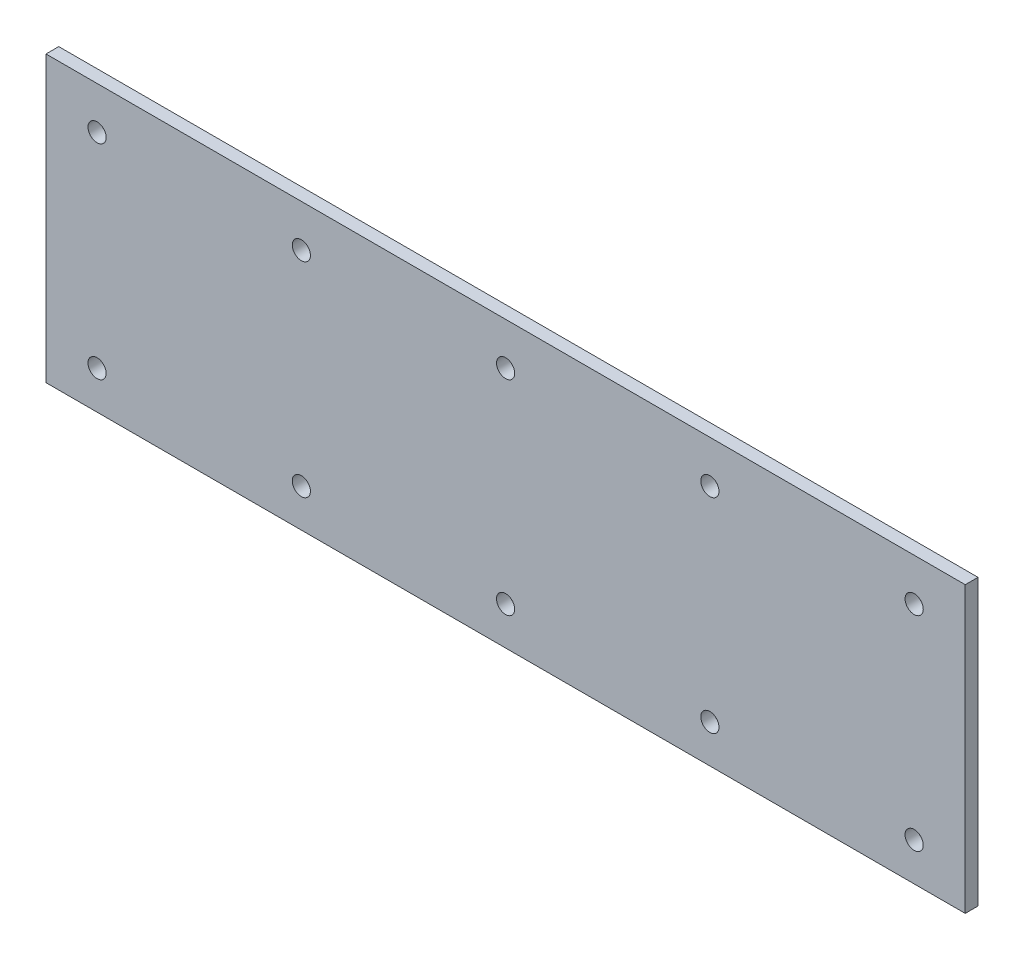
from build123d import *

# Parameters (mm, degrees)
SKETCH1_W             = 114.3
SKETCH1_H             = 35.4
BOSS_EXTRUDE1_DEPTH   = 1.5875
F_4_40_TAPPED_HOLE1_D = 2.2606
LPATTERN1_COUNT       = 5
LPATTERN1_PITCH       = 25.4


with BuildPart() as part:
    # Sketch1 → Boss-Extrude1 (new body)
    with BuildSketch(Plane.XY):
        Rectangle(SKETCH1_W, SKETCH1_H)
    extrude(amount=BOSS_EXTRUDE1_DEPTH)

    # #4-40 Tapped Hole1 (through all)
    with Locations(Plane(origin=(-50.8, 12.441291359, 1.5875), x_dir=(1, 0, 0), z_dir=(0, 0, 1))):
        with Locations((0, 0), (0, -25.4)):
            f_4_40_tapped_hole1 = Hole(F_4_40_TAPPED_HOLE1_D / 2)

    # LPattern1: #4-40 Tapped Hole1 ×5
    with Locations(*[(i * LPATTERN1_PITCH, 0, 0) for i in range(1, LPATTERN1_COUNT)]):
        add(f_4_40_tapped_hole1, mode=Mode.SUBTRACT)


solid = part.part
